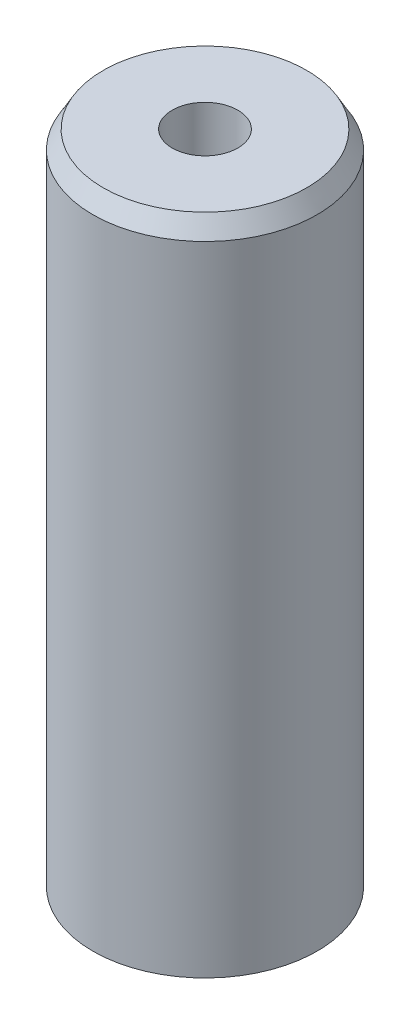
from build123d import *
from OCP.BRepFilletAPI import BRepFilletAPI_MakeChamfer

# Parameters (mm, degrees)
SKETCH1_R           = 32.5
BOSS_EXTRUDE1_DEPTH = 193.043494393
SKETCH2_R           = 9.512986605
CUT_EXTRUDE1_DEPTH  = 199.43964001
CHAMFER1_SIZE       = 5.230737787
CHAMFER1_SIZE2      = 3.013630006


with BuildPart() as part:
    # Sketch1 → Boss-Extrude1 (new body)
    with BuildSketch(Plane(origin=(0, 0, 0), x_dir=(1, 0, 0), z_dir=(0, 1, 0))):
        Circle(SKETCH1_R)
    extrude(amount=BOSS_EXTRUDE1_DEPTH)

    # Sketch2 → Cut-Extrude1 (cut, through all)
    with BuildSketch(Plane(origin=(0, 0, 0), x_dir=(1, 0, 0), z_dir=(0, 1, 0))):
        Circle(SKETCH2_R)
    extrude(amount=CUT_EXTRUDE1_DEPTH, mode=Mode.SUBTRACT)

    # Chamfer1: one chamfer whose edges measure the first distance from different faces: ONE call of the kernel's chamfer builder (chamfer() names one face for all edges)
    chamfer1_edges_1 = [part.edges().sort_by_distance(p)[0] for p in [
        (-32.5, 193.043494393, 0),
    ]]
    chamfer1_side_1 = [part.faces().sort_by_distance(p)[0] for p in [
        (-32.5, 96.521747196, 0),
    ]]
    chamfer1_edges_2 = [part.edges().sort_by_distance(p)[0] for p in [
        (-32.5, 0, 0),
    ]]
    chamfer1_side_2 = [part.faces().sort_by_distance(p)[0] for p in [
        (-31.580761184, 0, 0),
    ]]
    chamfer1 = BRepFilletAPI_MakeChamfer(part.part.solid().wrapped)
    for e in chamfer1_edges_1:
        chamfer1.Add(CHAMFER1_SIZE, CHAMFER1_SIZE2, e.wrapped, chamfer1_side_1[0].wrapped)  # the first distance lies on this face
    for e in chamfer1_edges_2:
        chamfer1.Add(CHAMFER1_SIZE, CHAMFER1_SIZE2, e.wrapped, chamfer1_side_2[0].wrapped)  # the first distance lies on this face
    add(Compound.cast(chamfer1.Shape()), mode=Mode.REPLACE)


solid = part.part
